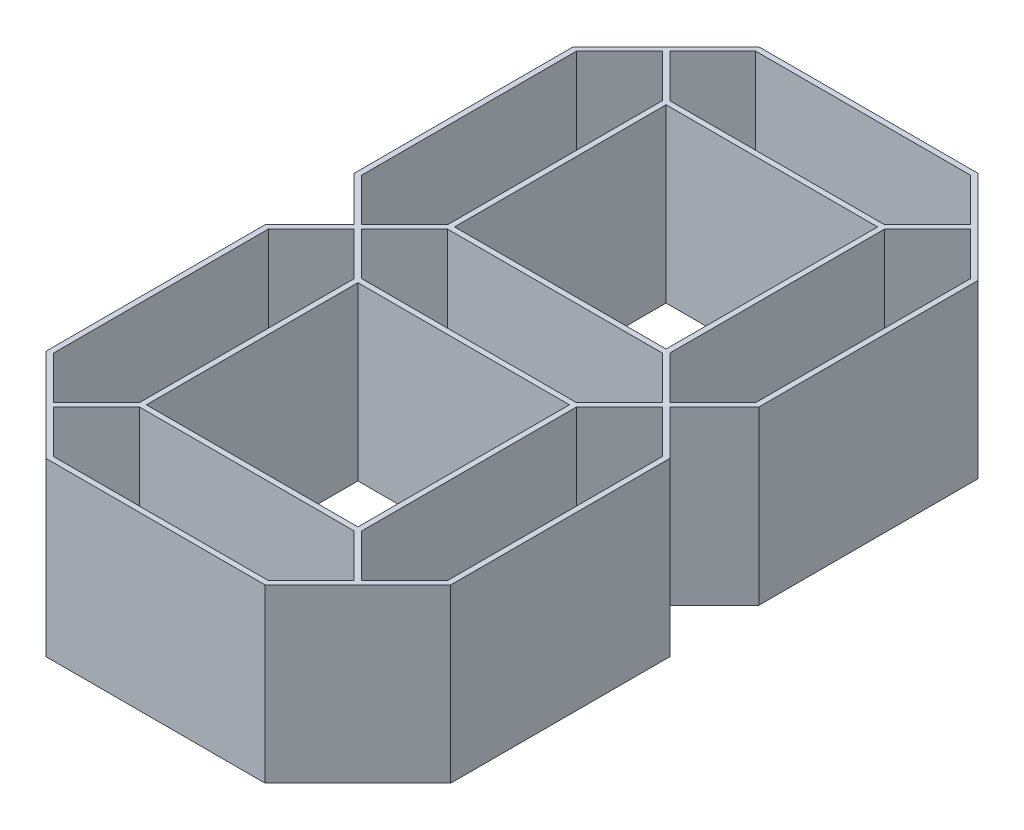
from build123d import *

# Parameters (mm, degrees)
SKETCH1_R               = 6
BOSS_EXTRUDE1_DEPTH     = 1.5875
EXTRUDE_THIN1_DEPTH     = 25.4
CIRPATTERN1_COUNT       = 4
MIRROR1_COPY_1_SKETCH_R = 6
MIRROR1_COPY_1_DEPTH    = 1.5875
MIRROR1_COPY_2_SKETCH_R = 6
MIRROR1_COPY_2_DEPTH    = 1.5875
MIRROR1_COPY_3_SKETCH_R = 6
MIRROR1_COPY_3_DEPTH    = 1.5875
MIRROR1_COPY_4_DEPTH    = 25.4
MIRROR1_COPY_5_DEPTH    = 25.4
MIRROR1_COPY_6_DEPTH    = 25.4
MIRROR1_COPY_7_SKETCH_R = 6
MIRROR1_COPY_7_DEPTH    = 1.5875
MIRROR1_COPY_8_DEPTH    = 25.4


with BuildPart() as part:
    # Sketch1 → Boss-Extrude1 (new body)
    with BuildSketch(Plane(origin=(0, 0, 0), x_dir=(1, 0, 0), z_dir=(0, 1, 0))):
        Polygon((-22.225, 0), (-15.875, 6.35), (15.875, 6.35), (22.225, 0), (15.875, -6.35), (-15.875, -6.35), align=None)
        with Locations((-9.525, 0)):
            Circle(SKETCH1_R, mode=Mode.SUBTRACT)
        with Locations((9.525, 0)):
            Circle(SKETCH1_R, mode=Mode.SUBTRACT)
    boss_extrude1 = extrude(amount=BOSS_EXTRUDE1_DEPTH)

    # Sketch2 → Extrude-Thin1 (add)
    with BuildSketch(Plane(origin=(0, 0, 0), x_dir=(1, 0, 0), z_dir=(0, 1, 0))):
        Polygon((-23.347532015, 0), (-16.203782015, -7.14375), (16.203782015, -7.14375), (23.347532015, 0), (16.203782015, 7.14375), (-16.203782015, 7.14375), align=None)
        Polygon((-22.225, 0), (-15.875, -6.35), (15.875, -6.35), (22.225, 0), (15.875, 6.35), (-15.875, 6.35), align=None, mode=Mode.SUBTRACT)
    extrude_thin1 = extrude(amount=EXTRUDE_THIN1_DEPTH)

    # CirPattern1: Boss-Extrude1, Extrude-Thin1 ×4 about axis
    cirpattern1_axis = Axis((0, 0, -22.786266008), (0, 1, 0))
    add([boss_extrude1.rotate(cirpattern1_axis, i * 360 / CIRPATTERN1_COUNT) for i in range(1, CIRPATTERN1_COUNT)])
    add([extrude_thin1.rotate(cirpattern1_axis, i * 360 / CIRPATTERN1_COUNT) for i in range(1, CIRPATTERN1_COUNT)])

    # Mirror1 copy 1 sketch → Mirror1 copy 1 (add)
    with BuildSketch(Plane(origin=(22.786266008, 0, 22.786266008), x_dir=(0, 0, 1), z_dir=(0, 1, 0))):
        Polygon((-22.225, 0), (-15.875, -6.35), (15.875, -6.35), (22.225, 0), (15.875, 6.35), (-15.875, 6.35), align=None)
        with Locations((-9.525, 0)):
            Circle(MIRROR1_COPY_1_SKETCH_R, mode=Mode.SUBTRACT)
        with Locations((9.525, 0)):
            Circle(MIRROR1_COPY_1_SKETCH_R, mode=Mode.SUBTRACT)
    extrude(amount=MIRROR1_COPY_1_DEPTH)

    # Mirror1 copy 2 sketch → Mirror1 copy 2 (add)
    with BuildSketch(Plane(origin=(0, 0, 45.572532015), x_dir=(-1, 0, 0), z_dir=(0, 1, 0))):
        Polygon((-22.225, 0), (-15.875, -6.35), (15.875, -6.35), (22.225, 0), (15.875, 6.35), (-15.875, 6.35), align=None)
        with Locations((-9.525, 0)):
            Circle(MIRROR1_COPY_2_SKETCH_R, mode=Mode.SUBTRACT)
        with Locations((9.525, 0)):
            Circle(MIRROR1_COPY_2_SKETCH_R, mode=Mode.SUBTRACT)
    extrude(amount=MIRROR1_COPY_2_DEPTH)

    # Mirror1 copy 3 sketch → Mirror1 copy 3 (add)
    with BuildSketch(Plane(origin=(-22.786266008, 0, 22.786266008), x_dir=(0, 0, -1), z_dir=(0, 1, 0))):
        Polygon((-22.225, 0), (-15.875, -6.35), (15.875, -6.35), (22.225, 0), (15.875, 6.35), (-15.875, 6.35), align=None)
        with Locations((-9.525, 0)):
            Circle(MIRROR1_COPY_3_SKETCH_R, mode=Mode.SUBTRACT)
        with Locations((9.525, 0)):
            Circle(MIRROR1_COPY_3_SKETCH_R, mode=Mode.SUBTRACT)
    extrude(amount=MIRROR1_COPY_3_DEPTH)

    # Mirror1 copy 4 sketch → Mirror1 copy 4 (add)
    with BuildSketch(Plane(origin=(22.786266008, 0, 22.786266008), x_dir=(0, 0, 1), z_dir=(0, 1, 0))):
        Polygon((-23.347532015, 0), (-16.203782015, 7.14375), (16.203782015, 7.14375), (23.347532015, 0), (16.203782015, -7.14375), (-16.203782015, -7.14375), align=None)
        Polygon((-22.225, 0), (-15.875, 6.35), (15.875, 6.35), (22.225, 0), (15.875, -6.35), (-15.875, -6.35), align=None, mode=Mode.SUBTRACT)
    extrude(amount=MIRROR1_COPY_4_DEPTH)

    # Mirror1 copy 5 sketch → Mirror1 copy 5 (add)
    with BuildSketch(Plane(origin=(0, 0, 45.572532015), x_dir=(-1, 0, 0), z_dir=(0, 1, 0))):
        Polygon((-23.347532015, 0), (-16.203782015, 7.14375), (16.203782015, 7.14375), (23.347532015, 0), (16.203782015, -7.14375), (-16.203782015, -7.14375), align=None)
        Polygon((-22.225, 0), (-15.875, 6.35), (15.875, 6.35), (22.225, 0), (15.875, -6.35), (-15.875, -6.35), align=None, mode=Mode.SUBTRACT)
    extrude(amount=MIRROR1_COPY_5_DEPTH)

    # Mirror1 copy 6 sketch → Mirror1 copy 6 (add)
    with BuildSketch(Plane(origin=(-22.786266008, 0, 22.786266008), x_dir=(0, 0, -1), z_dir=(0, 1, 0))):
        Polygon((-23.347532015, 0), (-16.203782015, 7.14375), (16.203782015, 7.14375), (23.347532015, 0), (16.203782015, -7.14375), (-16.203782015, -7.14375), align=None)
        Polygon((-22.225, 0), (-15.875, 6.35), (15.875, 6.35), (22.225, 0), (15.875, -6.35), (-15.875, -6.35), align=None, mode=Mode.SUBTRACT)
    extrude(amount=MIRROR1_COPY_6_DEPTH)

    # Mirror1 copy 7 sketch → Mirror1 copy 7 (add)
    with BuildSketch(Plane(origin=(0, 0, 0), x_dir=(1, 0, 0), z_dir=(0, 1, 0))):
        Polygon((-22.225, 0), (-15.875, -6.35), (15.875, -6.35), (22.225, 0), (15.875, 6.35), (-15.875, 6.35), align=None)
        with Locations((-9.525, 0)):
            Circle(MIRROR1_COPY_7_SKETCH_R, mode=Mode.SUBTRACT)
        with Locations((9.525, 0)):
            Circle(MIRROR1_COPY_7_SKETCH_R, mode=Mode.SUBTRACT)
    extrude(amount=MIRROR1_COPY_7_DEPTH)

    # Mirror1 copy 8 sketch → Mirror1 copy 8 (add)
    with BuildSketch(Plane(origin=(0, 0, 0), x_dir=(1, 0, 0), z_dir=(0, 1, 0))):
        Polygon((-23.347532015, 0), (-16.203782015, 7.14375), (16.203782015, 7.14375), (23.347532015, 0), (16.203782015, -7.14375), (-16.203782015, -7.14375), align=None)
        Polygon((-22.225, 0), (-15.875, 6.35), (15.875, 6.35), (22.225, 0), (15.875, -6.35), (-15.875, -6.35), align=None, mode=Mode.SUBTRACT)
    extrude(amount=MIRROR1_COPY_8_DEPTH)


solid = part.part
